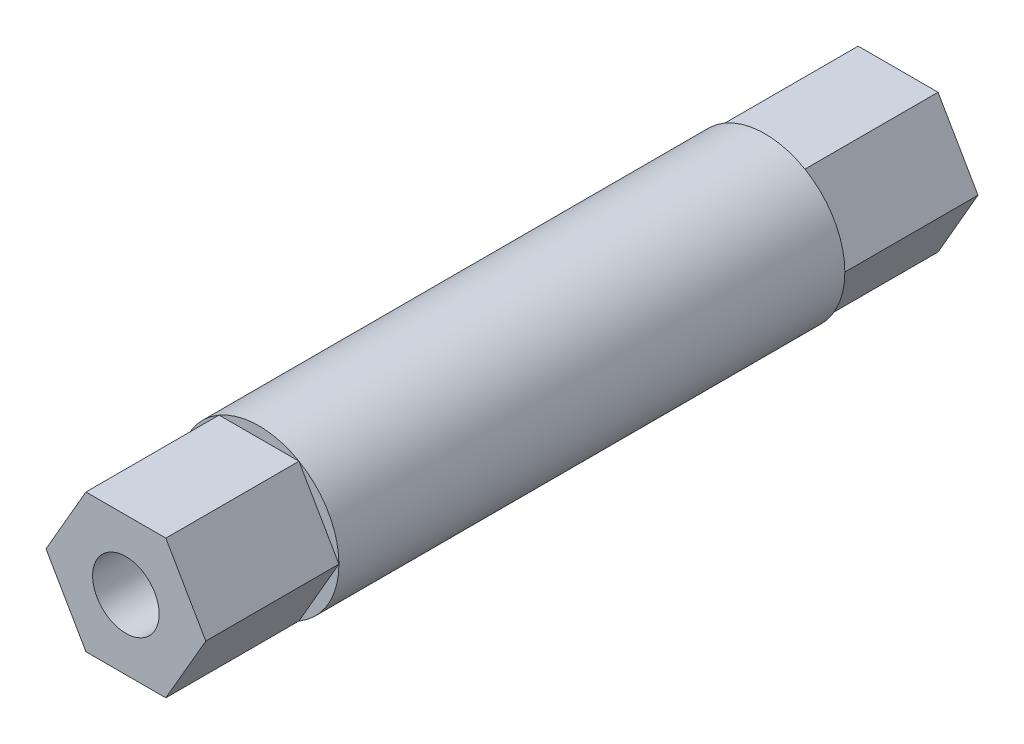
from build123d import *

# Parameters (mm, degrees)
SKETCH1_R           = 3
BOSS_EXTRUDE1_DEPTH = 29
CUT_EXTRUDE1_START  = -5
CUT_EXTRUDE1_DEPTH  = 5


with BuildPart() as part:
    # Sketch1 → Boss-Extrude1 (new body)
    with BuildSketch(Plane.XY):
        Circle(SKETCH1_R)
    extrude(amount=BOSS_EXTRUDE1_DEPTH)

    # Sketch3 → Cut-Extrude1 (cut)
    with BuildSketch(Plane.XY.offset(29).offset(CUT_EXTRUDE1_START)):
        with BuildLine():
            ThreePointArc((1.5, -2.598076211), (2.598076211, -1.5), (3, 0))
            Line((3, 0), (1.5, -2.598076211))
        make_face()
        with BuildLine():
            Line((1.5, 2.598076211), (3, 0))
            ThreePointArc((3, 0), (2.598076211, 1.5), (1.5, 2.598076211))
        make_face()
        with BuildLine():
            Line((-1.5, 2.598076211), (1.5, 2.598076211))
            ThreePointArc((1.5, 2.598076211), (0, 3), (-1.5, 2.598076211))
        make_face()
        with BuildLine():
            ThreePointArc((-1.5, -2.598076211), (0, -3), (1.5, -2.598076211))
            Line((1.5, -2.598076211), (-1.5, -2.598076211))
        make_face()
        with BuildLine():
            Line((-3, 0), (-1.5, 2.598076211))
            ThreePointArc((-1.5, 2.598076211), (-2.598076211, 1.5), (-3, 0))
        make_face()
        with BuildLine():
            ThreePointArc((-3, 0), (-2.598076211, -1.5), (-1.5, -2.598076211))
            Line((-1.5, -2.598076211), (-3, 0))
        make_face()
    cut_extrude1 = extrude(amount=CUT_EXTRUDE1_DEPTH, mode=Mode.SUBTRACT)

    # Mirror1: Cut-Extrude1 across plane
    add(cut_extrude1.mirror(Plane(origin=(0, 0, 14.5), x_dir=(1, 0, 0), z_dir=(0, 0, -1))), mode=Mode.SUBTRACT)

    # Sketch6 → Tap Drill for M3x0.5 Tap1 (revolve, cut)
    with BuildSketch(Plane(origin=(0, 0, 29), x_dir=(0, -1, 0), z_dir=(1, 0, 0))):
        Polygon((0, 0), (0, 5.751075774), (1.25, 5), (1.25, 0), align=None)
    tap_drill_for_m3x0_5_tap1 = revolve(axis=Axis((0, 0, 35.35), (0, 0, -1)), mode=Mode.SUBTRACT)

    # Mirror2: Tap Drill for M3x0.5 Tap1 across plane
    add(tap_drill_for_m3x0_5_tap1.mirror(Plane(origin=(0, 0, 14.5), x_dir=(1, 0, 0), z_dir=(0, 0, -1))), mode=Mode.SUBTRACT)


solid = part.part
